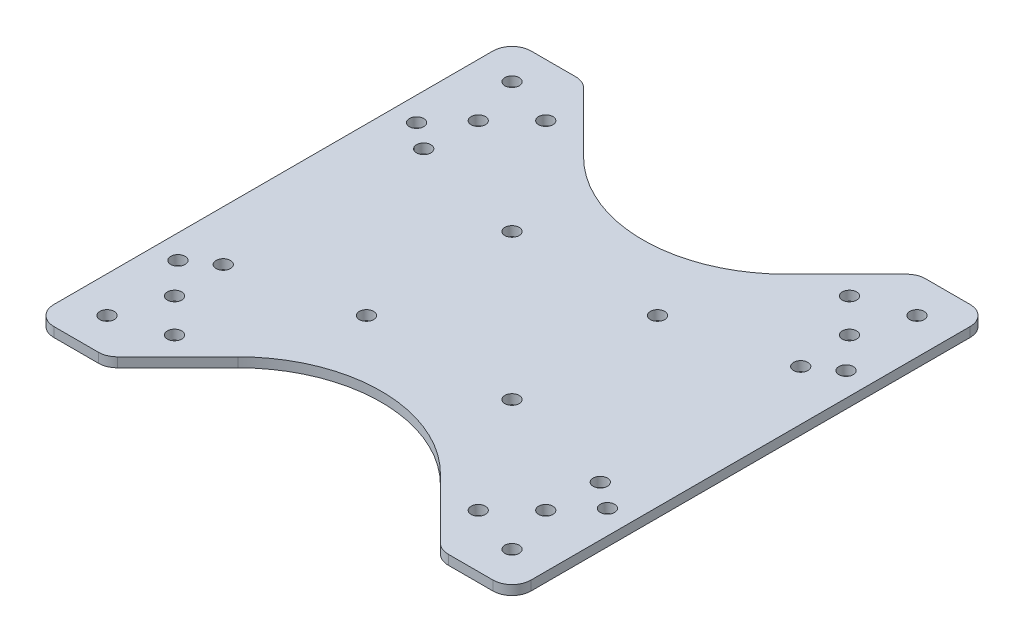
from build123d import *

# Parameters (mm, degrees)
SKETCH_1_W          = 100
SKETCH_1_H          = 100
EXTRUDE_1_DEPTH     = 2
SKETCH_3_R          = 1.5
CUT_EXTRUDE_2_DEPTH = 71.738956735
SKETCH_4_R          = 1.5
CUT_EXTRUDE_3_DEPTH = 71.738956735
CUT_EXTRUDE_6_DEPTH = 71.738956735
FILLET_2_R          = 30
SKETCH_7_R          = 1.5
CUT_EXTRUDE_7_DEPTH = 71.738956735
SKETCH_8_R          = 1.5
CUT_EXTRUDE_8_DEPTH = 71.738956735
FILLET_3_R          = 4


with BuildPart() as part:
    # 草图1 → 凸台-拉伸1 (new body)
    with BuildSketch(Plane(origin=(0, 0, 0), x_dir=(1, 0, 0), z_dir=(0, 1, 0))):
        Rectangle(SKETCH_1_W, SKETCH_1_H)
    extrude(amount=EXTRUDE_1_DEPTH)

    # 草图3 → 切除-拉伸2 (cut, through all)
    with BuildSketch(Plane(origin=(0, 2, 0), x_dir=(1, 0, 0), z_dir=(0, 1, 0))):
        with Locations((-42.426406871, 42.426406871)):
            Circle(SKETCH_3_R)
        with Locations((-31.819805153, 38.890872965)):
            Circle(SKETCH_3_R)
        with Locations((-38.890872965, 31.819805153)):
            Circle(SKETCH_3_R)
        with Locations((-31.819805153, -38.890872965)):
            Circle(SKETCH_3_R)
        with Locations((-38.890872965, -31.819805153)):
            Circle(SKETCH_3_R)
        with Locations((-42.426406871, -42.426406871)):
            Circle(SKETCH_3_R)
        with Locations((31.819805153, 38.890872965)):
            Circle(SKETCH_3_R)
        with Locations((38.890872965, 31.819805153)):
            Circle(SKETCH_3_R)
        with Locations((42.426406871, 42.426406871)):
            Circle(SKETCH_3_R)
        with Locations((31.819805153, -38.890872965)):
            Circle(SKETCH_3_R)
        with Locations((42.426406871, -42.426406871)):
            Circle(SKETCH_3_R)
        with Locations((38.890872965, -31.819805153)):
            Circle(SKETCH_3_R)
    extrude(amount=-CUT_EXTRUDE_2_DEPTH, mode=Mode.SUBTRACT)

    # 草图4 → 切除-拉伸3 (cut, through all)
    with BuildSketch(Plane.XZ):
        with Locations((-39.5, 21)):
            Circle(SKETCH_4_R)
        with Locations((39.5, 21)):
            Circle(SKETCH_4_R)
        with Locations((39.5, -21)):
            Circle(SKETCH_4_R)
        with Locations((-39.5, -21)):
            Circle(SKETCH_4_R)
    extrude(amount=-CUT_EXTRUDE_3_DEPTH, mode=Mode.SUBTRACT)

    # 草图6 → 切除-拉伸6 (cut, through all)
    with BuildSketch(Plane.XZ):
        Polygon((-35, 50), (0, 15), (35, 50), align=None)
        Polygon((0, -15), (35, -50), (-35, -50), align=None)
    extrude(amount=-CUT_EXTRUDE_6_DEPTH, mode=Mode.SUBTRACT)

    # 圆角2
    fillet_2_edges = [part.edges().sort_by_distance(p)[0] for p in [
        (0, 1, -15),
        (0, 1, 15),
    ]]
    fillet(fillet_2_edges, radius=FILLET_2_R)

    # 草图7 → 切除-拉伸7 (cut, through all)
    with BuildSketch(Plane.XZ):
        with Locations((-15.25, 15.25)):
            Circle(SKETCH_7_R)
        with Locations((15.25, 15.25)):
            Circle(SKETCH_7_R)
        with Locations((15.25, -15.25)):
            Circle(SKETCH_7_R)
        with Locations((-15.25, -15.25)):
            Circle(SKETCH_7_R)
    extrude(amount=-CUT_EXTRUDE_7_DEPTH, mode=Mode.SUBTRACT)

    # 草图8 → 切除-拉伸8 (cut, through all)
    with BuildSketch(Plane.XZ):
        with Locations((-45, 25)):
            Circle(SKETCH_8_R)
        with Locations((-45, -25)):
            Circle(SKETCH_8_R)
        with Locations((45, -25)):
            Circle(SKETCH_8_R)
        with Locations((45, 25)):
            Circle(SKETCH_8_R)
    extrude(amount=-CUT_EXTRUDE_8_DEPTH, mode=Mode.SUBTRACT)

    # 圆角3
    fillet_3_edges = [part.edges().sort_by_distance(p)[0] for p in [
        (35, 1, 50),
        (50, 1, 50),
        (50, 1, -50),
        (35, 1, -50),
        (-35, 1, -50),
        (-50, 1, -50),
        (-35, 1, 50),
        (-50, 1, 50),
    ]]
    fillet(fillet_3_edges, radius=FILLET_3_R)


solid = part.part
